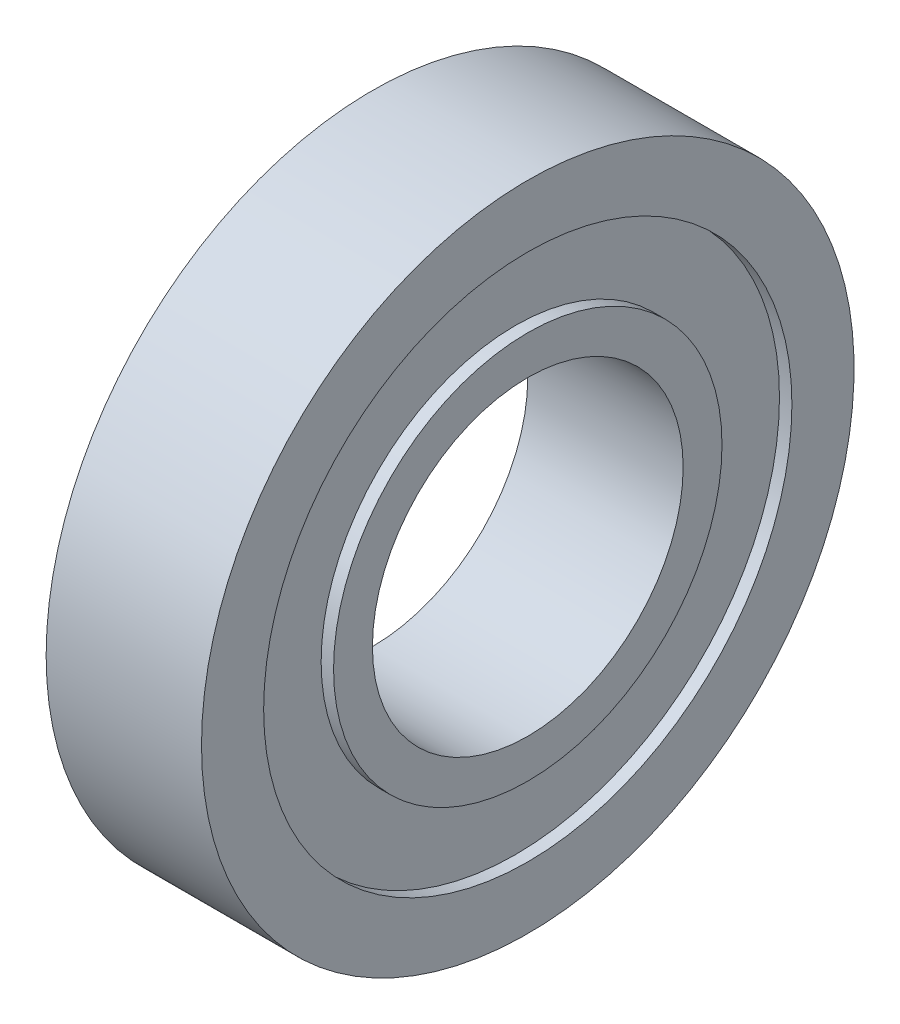
from build123d import *


with BuildPart() as part:
    # Sketch1 → Revolve1 (revolve)
    with BuildSketch(Plane(origin=(0, 0, 0), x_dir=(1, 0, 0), z_dir=(0, 1, 0))):
        Polygon((0, 5), (0, 6.25), (0.4, 6.25), (0.4, 8.5), (0, 8.5), (0, 10.5), (5, 10.5), (5, 8.5), (4.6, 8.5), (4.6, 6.25), (5, 6.25), (5, 5), align=None)
    revolve(axis=Axis((0, 0, 0), (1, 0, 0)))


solid = part.part
